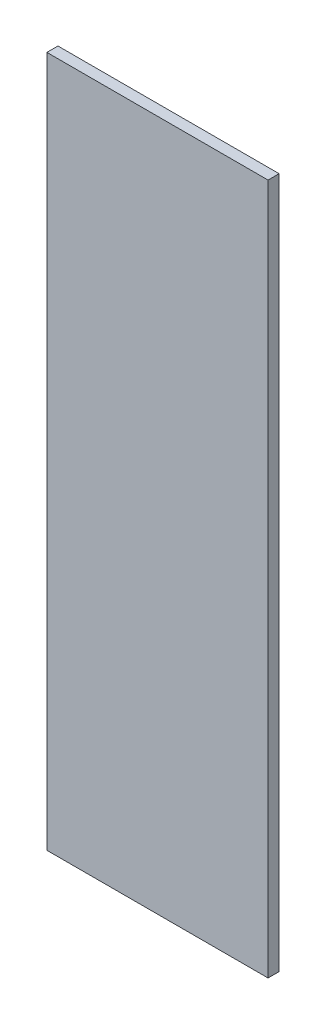
from build123d import *

# Parameters (mm, degrees)
SKETCH1_W          = 80
SKETCH1_H          = 250
BASE_FLANGE1_DEPTH = 4


# Sheet-metal steps are written as plain solids
with BuildPart() as part:
    # Sketch1 → Base-Flange1 (new body)
    with BuildSketch(Plane.XY):
        Rectangle(SKETCH1_W, SKETCH1_H)
    extrude(amount=-BASE_FLANGE1_DEPTH)


solid = part.part
